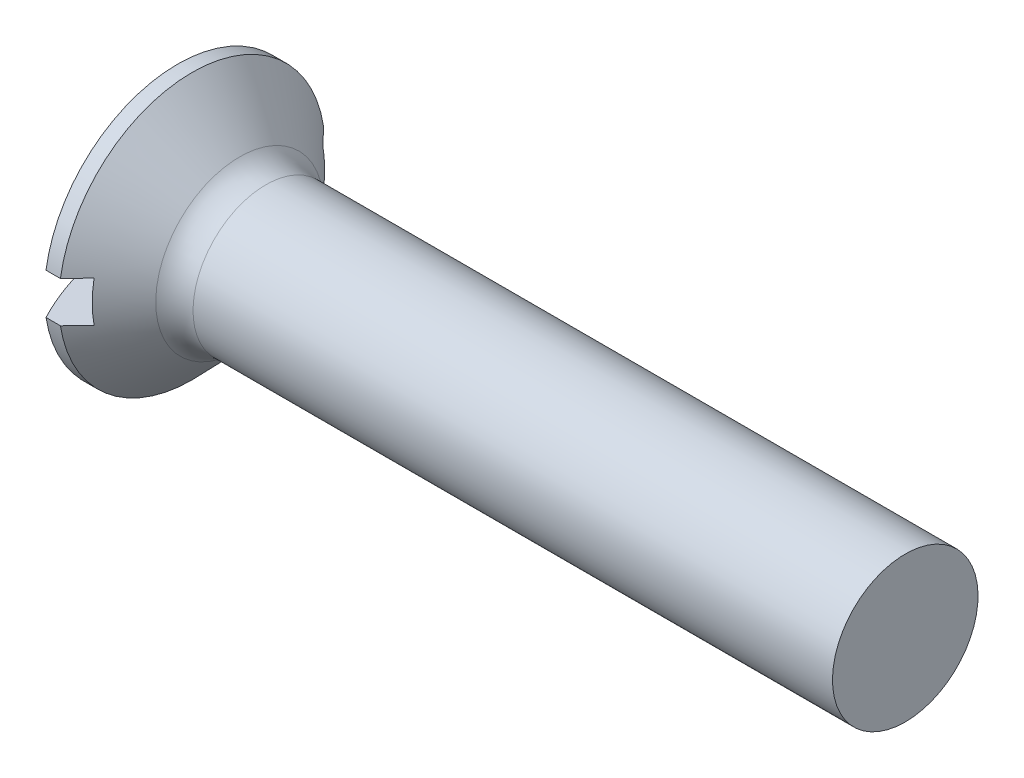
from build123d import *

# Parameters (mm, degrees)
FILLET1_R  = 2.5
SLOTSKE_W  = 18.3
SLOTSKE_H  = 2.81
SLOT_DEPTH = 4.4


with BuildPart() as part:
    # BodySke → BaseBody (revolve)
    with BuildSketch(Plane.XY):
        with BuildLine():
            Line((2.280026132, 9.15), (3.272417717, 9.15))
            Line((3.272417717, 9.15), (7.280026132, 5))
            Line((7.280026132, 5), (52.280026132, 5))
            Line((52.280026132, 5), (52.280026132, 0))
            Line((52.280026132, 0), (2.280026132, 0))
            Line((2.280026132, 0), (0, 0))
            ThreePointArc((0, 0), (0.578590295, 4.714897114), (2.280026132, 9.15))
        make_face()
    revolve(axis=Axis((2.280026132, 0, 0), (1, 0, 0)))

    # Fillet1
    fillet1_edges = [part.edges().sort_by_distance(p)[0] for p in [
        (7.280026132, -5, 0),
    ]]
    fillet(fillet1_edges, radius=FILLET1_R)

    # SlotSke → Slot (cut)
    with BuildSketch(Plane(origin=(0, 0, 0), x_dir=(0, 0, -1), z_dir=(1, 0, 0))):
        Rectangle(SLOTSKE_W, SLOTSKE_H)
    extrude(amount=SLOT_DEPTH, mode=Mode.SUBTRACT)


solid = part.part
